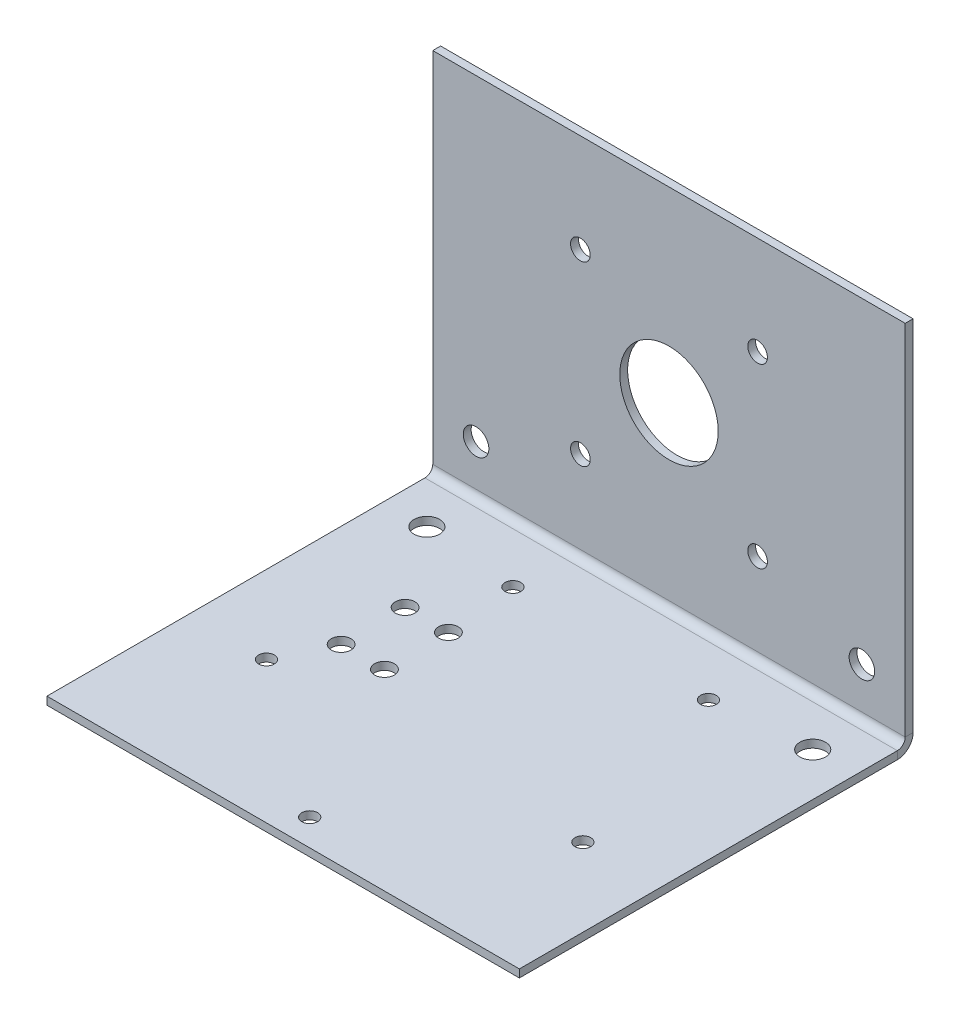
from build123d import *

# Parameters (mm, degrees)
SKETCH2_W                    = 120
SKETCH2_H                    = 95
SKETCH2_R                    = 12.5
SKETCH2_R_2                  = 2.5
SKETCH2_R_3                  = 3.25
BASE_FLANGE1_DEPTH           = 2
EDGE_FLANGE1_STRIP_W         = 12
EDGE_FLANGE1_STRIP_H         = 2
EDGE_FLANGE1_STRIP_CUT_DEPTH = 120
EDGE_FLANGE1_DEPTH           = 120
EDGE_FLANGE1_PROFILE_W       = 120
EDGE_FLANGE1_PROFILE_H       = 96
EDGE_FLANGE1_PROFILE_R       = 3.25
EDGE_FLANGE1_PROFILE_R_2     = 2
EDGE_FLANGE1_PROFILE_R_3     = 2.5
EDGE_FLANGE1_FLAT_DEPTH      = 2


# Sheet-metal steps are written as plain solids
with BuildPart() as part:
    # Sketch2 → Base-Flange1 (new body)
    with BuildSketch(Plane.XY):
        with Locations((60, 47.5)):
            Rectangle(SKETCH2_W, SKETCH2_H)
        with Locations((60, 47.5)):
            Circle(SKETCH2_R, mode=Mode.SUBTRACT)
        with Locations((82.5, 70)):
            Circle(SKETCH2_R_2, mode=Mode.SUBTRACT)
        with Locations((37.5, 70)):
            Circle(SKETCH2_R_2, mode=Mode.SUBTRACT)
        with Locations((37.5, 25)):
            Circle(SKETCH2_R_2, mode=Mode.SUBTRACT)
        with Locations((82.5, 25)):
            Circle(SKETCH2_R_2, mode=Mode.SUBTRACT)
        with Locations((11, 14.5)):
            Circle(SKETCH2_R_3, mode=Mode.SUBTRACT)
        with Locations(Location((109, 14.5, 0), (0, 0, 180))):
            Circle(SKETCH2_R_3, mode=Mode.SUBTRACT)
    extrude(amount=-BASE_FLANGE1_DEPTH)

    # Edge-Flange1 strip (across the edge) → Edge-Flange1 strip cut (cut)
    with BuildSketch(Plane.YZ):
        with Locations((-2, -1)):
            Rectangle(EDGE_FLANGE1_STRIP_W, EDGE_FLANGE1_STRIP_H)
    extrude(amount=EDGE_FLANGE1_STRIP_CUT_DEPTH, mode=Mode.SUBTRACT)

    # Edge-Flange1 bend section (across the edge) → Edge-Flange1 (add)
    with BuildSketch(Plane.YZ):
        with BuildLine():
            Line((0, 2), (2, 2))
            ThreePointArc((2, 2), (2.585786438, 0.585786438), (4, 0))
            Line((4, 0), (4, -2))
            ThreePointArc((4, -2), (1.171572875, -0.828427125), (0, 2))
        make_face()
    extrude(amount=EDGE_FLANGE1_DEPTH)

    # Edge-Flange1 profile (on flange) → Edge-Flange1 flat (add)
    with BuildSketch(Plane.XZ):
        with Locations((60, 50)):
            Rectangle(EDGE_FLANGE1_PROFILE_W, EDGE_FLANGE1_PROFILE_H)
        with Locations((11, 12.5)):
            Circle(EDGE_FLANGE1_PROFILE_R, mode=Mode.SUBTRACT)
        with Locations((35.166073091, 14.819031988)):
            Circle(EDGE_FLANGE1_PROFILE_R_2, mode=Mode.SUBTRACT)
        with Locations((25.98, 33)):
            Circle(EDGE_FLANGE1_PROFILE_R_3, mode=Mode.SUBTRACT)
        with Locations((25.98, 49.25)):
            Circle(EDGE_FLANGE1_PROFILE_R_3, mode=Mode.SUBTRACT)
        with Locations((36.98, 33)):
            Circle(EDGE_FLANGE1_PROFILE_R_3, mode=Mode.SUBTRACT)
        with Locations((36.98, 49.25)):
            Circle(EDGE_FLANGE1_PROFILE_R_3, mode=Mode.SUBTRACT)
        with Locations((84.833926909, 14.819031988)):
            Circle(EDGE_FLANGE1_PROFILE_R_2, mode=Mode.SUBTRACT)
        with Locations((109, 12.5)):
            Circle(EDGE_FLANGE1_PROFILE_R, mode=Mode.SUBTRACT)
        with Locations((19.817862187, 62.055968012)):
            Circle(EDGE_FLANGE1_PROFILE_R_2, mode=Mode.SUBTRACT)
        with Locations((100.182137813, 62.055968012)):
            Circle(EDGE_FLANGE1_PROFILE_R_2, mode=Mode.SUBTRACT)
        with Locations((60, 91.25)):
            Circle(EDGE_FLANGE1_PROFILE_R_2, mode=Mode.SUBTRACT)
    extrude(amount=-EDGE_FLANGE1_FLAT_DEPTH)


solid = part.part
